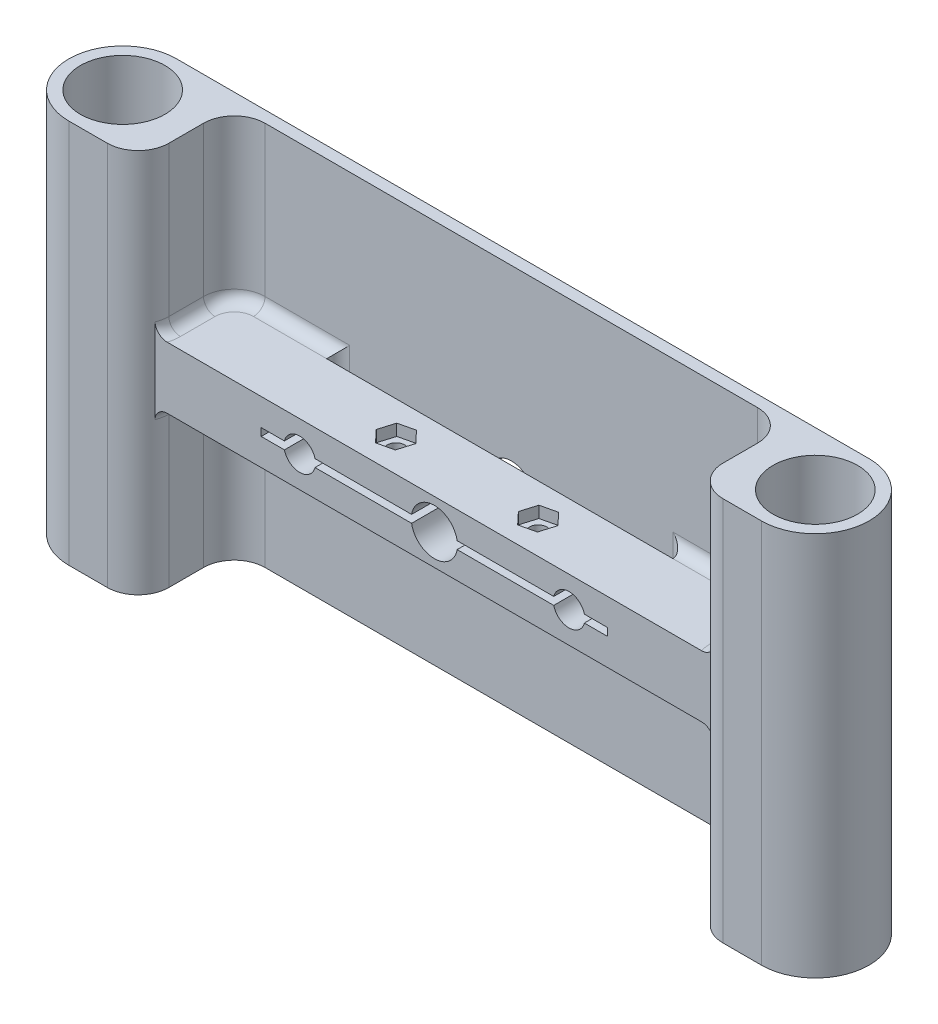
from build123d import *

# Parameters (mm, degrees)
SKETCH1_R                    = 11
BOSS_EXTRUDE1_DEPTH          = 100
FILLET1_R                    = 8
SKETCH2_R                    = 4.1
SKETCH2_R_2                  = 6
CUT_EXTRUDE1_DEPTH           = 10
BOSS_EXTRUDE2_START          = 20
SKETCH3_R                    = 4.1
SKETCH3_R_2                  = 6
BOSS_EXTRUDE2_DEPTH          = 20
FILLET2_R                    = 3
CUT_EXTRUDE_THIN1_DEPTH      = 183.94618817
CUT_EXTRUDE_THIN1_DEPTH_BACK = 20
CUT_EXTRUDE_THIN2_DEPTH      = 163.832913644
CUT_EXTRUDE_THIN2_DEPTH_BACK = 20
FILLET3_R                    = 3
CUT_EXTRUDE2_DEPTH           = 161.472919104
CUT_EXTRUDE2_DEPTH_BACK      = 161.472919104
SKETCH6_R                    = 2.25
CUT_EXTRUDE3_DEPTH           = 3


with BuildPart() as part:
    # Sketch1 → Boss-Extrude1 (new body)
    with BuildSketch(Plane(origin=(0, 0, 0), x_dir=(1, 0, 0), z_dir=(0, 1, 0))):
        with BuildLine():
            Line((137.460581558, -14.5), (119.460581558, -14.5))
            Line((119.460581558, -14.5), (119.460581558, 10.5))
            Line((119.460581558, 10.5), (-24.539418442, 10.5))
            Line((-24.539418442, 10.5), (-24.539418442, -14.5))
            Line((-24.539418442, -14.5), (-42.539418442, -14.5))
            ThreePointArc((-42.539418442, -14.5), (-56.539418442, -0.5), (-42.539418442, 13.5))
            Line((-42.539418442, 13.5), (137.460581558, 13.5))
            ThreePointArc((137.460581558, 13.5), (151.460581558, -0.5), (137.460581558, -14.5))
        make_face()
        with Locations(Location((-42.539418442, -0.5, 0), (0, 0, 270))):
            Circle(SKETCH1_R, mode=Mode.SUBTRACT)
        with Locations(Location((137.460581558, -0.5, 0), (0, 0, 270))):
            Circle(SKETCH1_R, mode=Mode.SUBTRACT)
    extrude(amount=BOSS_EXTRUDE1_DEPTH)

    # Fillet1
    fillet1_edges = [part.edges().sort_by_distance(p)[0] for p in [
        (119.460581558, 50, 14.5),
        (119.460581558, 50, -10.5),
        (-24.539418442, 50, -10.5),
        (-24.539418442, 50, 14.5),
    ]]
    fillet(fillet1_edges, radius=FILLET1_R)

    # Sketch2 → Cut-Extrude1 (cut)
    with BuildSketch(Plane.XY.offset(-10.5)):
        with Locations((12.460581558, 50)):
            Circle(SKETCH2_R)
        with Locations((82.460581558, 50)):
            Circle(SKETCH2_R)
        with Locations((47.460581558, 50)):
            Circle(SKETCH2_R_2)
    extrude(amount=-CUT_EXTRUDE1_DEPTH, mode=Mode.SUBTRACT)

    # Sketch3 → Boss-Extrude2 (add)
    with BuildSketch(Plane.XY.offset(-10.5).offset(BOSS_EXTRUDE2_START)):
        Polygon((12.460581558, 58), (82.460581558, 58), (124.149440998, 58), (124.149440998, 42), (82.460581558, 42), (12.460581558, 42), (-28.8662965, 42), (-28.8662965, 58), (-16.539418442, 58), align=None)
        with Locations((12.460581558, 50)):
            Circle(SKETCH3_R, mode=Mode.SUBTRACT)
        with Locations((82.460581558, 50)):
            Circle(SKETCH3_R, mode=Mode.SUBTRACT)
        with Locations((47.460581558, 50)):
            Circle(SKETCH3_R_2, mode=Mode.SUBTRACT)
    extrude(amount=-BOSS_EXTRUDE2_DEPTH)

    # Fillet2
    fillet2_edges = [part.edges().sort_by_distance(p)[0] for p in [
        (-24.686725022, 58, 8.0281381),
        (-24.686725022, 42, 8.0281381),
        (47.460581558, 42, -10.5),
        (117.117435807, 42, -8.156854249),
        (119.460581558, 42, 2),
        (-24.539418442, 42, 2),
        (-22.196272692, 42, -8.156854249),
        (119.607888138, 42, 8.0281381),
        (119.460581558, 58, 2),
        (117.117435807, 58, -8.156854249),
        (47.460581558, 58, -10.5),
        (-22.196272692, 58, -8.156854249),
        (-24.539418442, 58, 2),
        (119.607888138, 58, 8.0281381),
    ]]
    fillet(fillet2_edges, radius=FILLET2_R)

    # Sketch4 → Cut-Extrude-Thin1 (cut, two sides: drawn at the far end of the back side and taken through both)
    with BuildSketch(Plane.XY.offset(9.5).offset(-CUT_EXTRUDE_THIN1_DEPTH_BACK)):
        Polygon((92.460581558, 51), (47.460581558, 51), (2.460581558, 51), (2.460581558, 49), (47.460581558, 49), (92.460581558, 49), align=None)
    extrude(amount=CUT_EXTRUDE_THIN1_DEPTH + CUT_EXTRUDE_THIN1_DEPTH_BACK, mode=Mode.SUBTRACT)

    # Sketch5 → Cut-Extrude-Thin2 (cut, two sides: drawn at the far end of the back side and taken through both)
    with BuildSketch(Plane(origin=(0, 42, 0), x_dir=(-1, 0, 0), z_dir=(0, -1, 0)).offset(-CUT_EXTRUDE_THIN2_DEPTH_BACK)):
        Polygon((-2.460581558, 7.5), (-47.460581558, 7.5), (-92.460581558, 7.5), (-92.460581558, 10.5), (-47.460581558, 10.5), (-2.460581558, 10.5), align=None)
    extrude(amount=CUT_EXTRUDE_THIN2_DEPTH + CUT_EXTRUDE_THIN2_DEPTH_BACK, mode=Mode.SUBTRACT)

    # Fillet3
    fillet3_edges = [part.edges().sort_by_distance(p)[0] for p in [
        (2.460581558, 50, -10.5),
        (92.460581558, 50, -10.5),
    ]]
    fillet(fillet3_edges, radius=FILLET3_R - 0.0001)  # a hair under: the kernel refuses the full size

    # Sketch6 → Cut-Extrude2 (cut, two sides: drawn at the far end of the back side and taken through both)
    with BuildSketch(Plane(origin=(0, 49, 0), x_dir=(1, 0, 0), z_dir=(0, 1, 0)).offset(-CUT_EXTRUDE2_DEPTH_BACK)):
        with Locations(Location((28.990631201, -1, 0), (0, 0, 270))):
            Circle(SKETCH6_R)
        with Locations(Location((65.930531914, -1, 0), (0, 0, 270))):
            Circle(SKETCH6_R)
    extrude(amount=CUT_EXTRUDE2_DEPTH + CUT_EXTRUDE2_DEPTH_BACK, mode=Mode.SUBTRACT)

    # Sketch7 → Cut-Extrude3 (cut)
    with BuildSketch(Plane(origin=(0, 58, 0), x_dir=(1, 0, 0), z_dir=(0, 1, 0))):
        Polygon((33.150591825, -0.026315789), (30.227376252, 3.089473684), (26.067415628, 2.115789474), (24.830670578, -1.973684211), (27.753886151, -5.089473684), (31.913846775, -4.115789474), align=None)
        Polygon((70.090492538, -0.026315789), (67.167276964, 3.089473684), (63.007316341, 2.115789474), (61.77057129, -1.973684211), (64.693786864, -5.089473684), (68.853747488, -4.115789474), align=None)
    extrude(amount=-CUT_EXTRUDE3_DEPTH, mode=Mode.SUBTRACT)


solid = part.part
